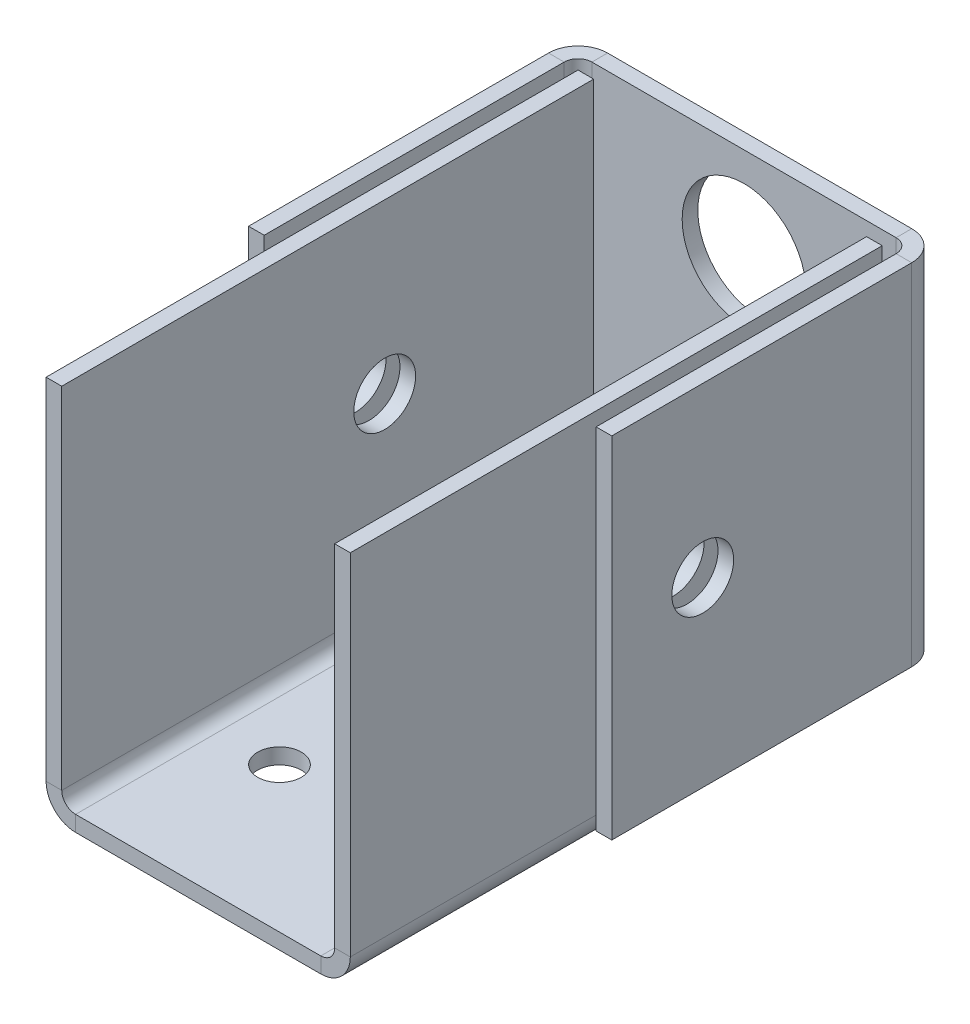
from build123d import *

# Parameters (mm, degrees)
SKETCH1_W                    = 15
SKETCH1_H                    = 30
BASE_FLANGE1_DEPTH           = 0.86
EDGE_FLANGE1_STRIP_W         = 4.964
EDGE_FLANGE1_STRIP_H         = 0.86
EDGE_FLANGE1_STRIP_CUT_DEPTH = 15
EDGE_FLANGE1_DEPTH           = 15
EDGE_FLANGE2_STRIP_W         = 4.964
EDGE_FLANGE2_STRIP_H         = 0.86
EDGE_FLANGE2_STRIP_CUT_DEPTH = 29.238
EDGE_FLANGE2_DEPTH           = 29.238
EDGE_FLANGE3_STRIP_W         = 4.964
EDGE_FLANGE3_STRIP_H         = 0.86
EDGE_FLANGE3_STRIP_CUT_DEPTH = 29.238
EDGE_FLANGE3_DEPTH           = 29.238
EDGE_FLANGE4_START           = 0.762
EDGE_FLANGE4_DEPTH           = 19.238
EDGE_FLANGE5_START           = 0.762
EDGE_FLANGE5_DEPTH           = 19.238
SKETCH21_R                   = 3.4
CUT_EXTRUDE1_DEPTH           = 10
M3_CLEARANCE_HOLE2_D         = 3.4
M2_CLEARANCE_HOLE1_D         = 2.4
M2_CLEARANCE_HOLE1_DEPTH     = 12
M2_CLEARANCE_HOLE1_TIP       = 0.721032743


# Read off the part's stored shape, not the designer's step: Edge-Flange4, Edge-Flange5
# Sheet-metal steps are written as plain solids
with BuildPart() as part:
    # Sketch1 → Base-Flange1 (new body)
    with BuildSketch(Plane(origin=(0, 0, 0), x_dir=(1, 0, 0), z_dir=(0, 1, 0))):
        Rectangle(SKETCH1_W, SKETCH1_H)
    extrude(amount=-BASE_FLANGE1_DEPTH)

    # Edge-Flange1 strip (across the edge) → Edge-Flange1 strip cut (cut)
    with BuildSketch(Plane(origin=(7.5, 0, -15), x_dir=(0, 0, 1), z_dir=(-1, 0, 0))):
        with Locations((-1.72, -0.43)):
            Rectangle(EDGE_FLANGE1_STRIP_W, EDGE_FLANGE1_STRIP_H)
    extrude(amount=EDGE_FLANGE1_STRIP_CUT_DEPTH, mode=Mode.SUBTRACT)

    # Edge-Flange1 section (across the edge) → Edge-Flange1 (add)
    with BuildSketch(Plane(origin=(7.5, 0, -15), x_dir=(0, 0, 1), z_dir=(-1, 0, 0))):
        with BuildLine():
            Line((-0.86, 0.762), (-0.86, 20))
            Line((-0.86, 20), (0, 20))
            Line((0, 20), (0, 0.762))
            ThreePointArc((0, 0.762), (0.223184633, 0.223184633), (0.762, 0))
            Line((0.762, 0), (0.762, -0.86))
            ThreePointArc((0.762, -0.86), (-0.384927199, -0.384927199), (-0.86, 0.762))
        make_face()
    extrude(amount=EDGE_FLANGE1_DEPTH)

    # Edge-Flange2 strip (across the edge) → Edge-Flange2 strip cut (cut)
    with BuildSketch(Plane(origin=(7.5, 0, 15), x_dir=(-1, 0, 0), z_dir=(0, 0, -1))):
        with Locations((-1.72, -0.43)):
            Rectangle(EDGE_FLANGE2_STRIP_W, EDGE_FLANGE2_STRIP_H)
    extrude(amount=EDGE_FLANGE2_STRIP_CUT_DEPTH, mode=Mode.SUBTRACT)

    # Edge-Flange2 section (across the edge) → Edge-Flange2 (add)
    with BuildSketch(Plane(origin=(7.5, 0, 15), x_dir=(-1, 0, 0), z_dir=(0, 0, -1))):
        with BuildLine():
            Line((-0.86, 0.762), (-0.86, 20))
            Line((-0.86, 20), (0, 20))
            Line((0, 20), (0, 0.762))
            ThreePointArc((0, 0.762), (0.223184633, 0.223184633), (0.762, 0))
            Line((0.762, 0), (0.762, -0.86))
            ThreePointArc((0.762, -0.86), (-0.384927199, -0.384927199), (-0.86, 0.762))
        make_face()
    extrude(amount=EDGE_FLANGE2_DEPTH)

    # Edge-Flange3 strip (across the edge) → Edge-Flange3 strip cut (cut)
    with BuildSketch(Plane(origin=(-7.5, 0, -14.238), x_dir=(1, 0, 0), z_dir=(0, 0, 1))):
        with Locations((-1.72, -0.43)):
            Rectangle(EDGE_FLANGE3_STRIP_W, EDGE_FLANGE3_STRIP_H)
    extrude(amount=EDGE_FLANGE3_STRIP_CUT_DEPTH, mode=Mode.SUBTRACT)

    # Edge-Flange3 section (across the edge) → Edge-Flange3 (add)
    with BuildSketch(Plane(origin=(-7.5, 0, -14.238), x_dir=(1, 0, 0), z_dir=(0, 0, 1))):
        with BuildLine():
            Line((-0.86, 0.762), (-0.86, 20))
            Line((-0.86, 20), (0, 20))
            Line((0, 20), (0, 0.762))
            ThreePointArc((0, 0.762), (0.223184633, 0.223184633), (0.762, 0))
            Line((0.762, 0), (0.762, -0.86))
            ThreePointArc((0.762, -0.86), (-0.384927199, -0.384927199), (-0.86, 0.762))
        make_face()
    extrude(amount=EDGE_FLANGE3_DEPTH)

    # Edge-Flange4 outline → Edge-Flange4 (add)
    with BuildSketch(Plane(origin=(0, 0, 0), x_dir=(1, 0, 0), z_dir=(0, 1, 0)).offset(EDGE_FLANGE4_START)):
        with BuildLine():
            ThreePointArc((-8.36, 15.86), (-9.506927199, 15.384927199), (-9.982, 14.238))
            Line((-9.982, 14.238), (-9.982, -2.25))
            Line((-9.982, -2.25), (-9.122, -2.25))
            Line((-9.122, -2.25), (-9.122, 14.238))
            ThreePointArc((-9.122, 14.238), (-8.898815367, 14.776815367), (-8.36, 15))
            Line((-8.36, 15), (-7.5, 15))
            Line((-7.5, 15), (-7.5, 15.86))
            Line((-7.5, 15.86), (-8.36, 15.86))
        make_face()
    extrude(amount=EDGE_FLANGE4_DEPTH)

    # Edge-Flange5 outline → Edge-Flange5 (add)
    with BuildSketch(Plane(origin=(0, 0, 0), x_dir=(1, 0, 0), z_dir=(0, 1, 0)).offset(EDGE_FLANGE5_START)):
        with BuildLine():
            Line((9.122, -2.25), (9.982, -2.25))
            Line((9.982, -2.25), (9.982, 14.238))
            ThreePointArc((9.982, 14.238), (9.506927199, 15.384927199), (8.36, 15.86))
            Line((8.36, 15.86), (7.5, 15.86))
            Line((7.5, 15.86), (7.5, 15))
            Line((7.5, 15), (8.36, 15))
            ThreePointArc((8.36, 15), (8.898815367, 14.776815367), (9.122, 14.238))
            Line((9.122, 14.238), (9.122, -2.25))
        make_face()
    extrude(amount=EDGE_FLANGE5_DEPTH)

    # Sketch21 → Cut-Extrude1 (cut)
    with BuildSketch(Plane(origin=(0, 0, -15.86), x_dir=(-1, 0, 0), z_dir=(0, 0, -1))):
        with Locations(Location((0, 15, 0), (0, 0, 90))):
            Circle(SKETCH21_R)
    extrude(amount=-CUT_EXTRUDE1_DEPTH, mode=Mode.SUBTRACT)

    # M3 Clearance Hole2 (through all)
    with Locations(Plane.ZY.offset(9.982)):
        with Locations((-2.75, 10.762)):
            Hole(M3_CLEARANCE_HOLE2_D / 2)

    # M2 Clearance Hole1
    with Locations(Plane(origin=(0, 0, 0), x_dir=(1, 0, 0), z_dir=(0, 1, 0))):
        with Locations((2.738, -7.031765706), (-3.5, -7.031765706)):
            Hole(M2_CLEARANCE_HOLE1_D / 2, depth=M2_CLEARANCE_HOLE1_DEPTH)
            with Locations((0, 0, -(M2_CLEARANCE_HOLE1_DEPTH + M2_CLEARANCE_HOLE1_TIP / 2))):  # 118° drill point
                Cone(0, M2_CLEARANCE_HOLE1_D / 2, M2_CLEARANCE_HOLE1_TIP, mode=Mode.SUBTRACT)


solid = part.part
